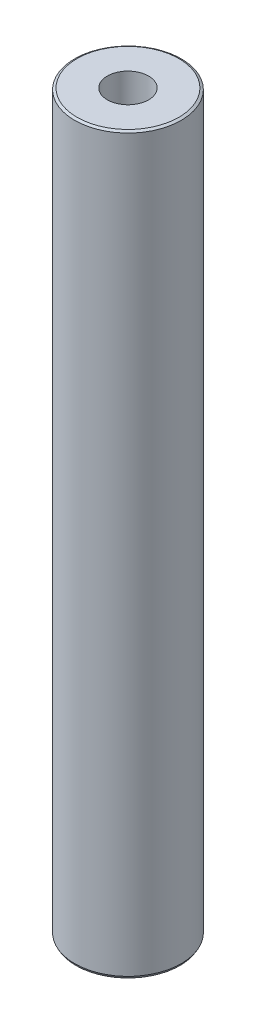
from build123d import *
from OCP.BRepFilletAPI import BRepFilletAPI_MakeChamfer

# Parameters (mm, degrees)
SKETCH1_R           = 22.5
BOSS_EXTRUDE1_DEPTH = 309.739403862
SKETCH2_R           = 8.718493885
CUT_EXTRUDE1_DEPTH  = 312.36955263
CHAMFER1_SIZE       = 0.589991103
CHAMFER1_SIZE2      = 1.021894566


with BuildPart() as part:
    # Sketch1 → Boss-Extrude1 (new body)
    with BuildSketch(Plane(origin=(0, 0, 0), x_dir=(1, 0, 0), z_dir=(0, 1, 0))):
        Circle(SKETCH1_R)
    extrude(amount=BOSS_EXTRUDE1_DEPTH)

    # Sketch2 → Cut-Extrude1 (cut, through all)
    with BuildSketch(Plane(origin=(0, 0, 0), x_dir=(1, 0, 0), z_dir=(0, 1, 0))):
        Circle(SKETCH2_R)
    extrude(amount=CUT_EXTRUDE1_DEPTH, mode=Mode.SUBTRACT)

    # Chamfer1: one chamfer whose edges measure the first distance from different faces: ONE call of the kernel's chamfer builder (chamfer() names one face for all edges)
    chamfer1_edges_1 = [part.edges().sort_by_distance(p)[0] for p in [
        (-22.5, 309.739403862, 0),
    ]]
    chamfer1_side_1 = [part.faces().sort_by_distance(p)[0] for p in [
        (-22.5, 154.869701931, 0),
    ]]
    chamfer1_edges_2 = [part.edges().sort_by_distance(p)[0] for p in [
        (-22.5, 0, 0),
    ]]
    chamfer1_side_2 = [part.faces().sort_by_distance(p)[0] for p in [
        (-21.863603897, 0, 0),
    ]]
    chamfer1 = BRepFilletAPI_MakeChamfer(part.part.solid().wrapped)
    for e in chamfer1_edges_1:
        chamfer1.Add(CHAMFER1_SIZE, CHAMFER1_SIZE2, e.wrapped, chamfer1_side_1[0].wrapped)  # the first distance lies on this face
    for e in chamfer1_edges_2:
        chamfer1.Add(CHAMFER1_SIZE, CHAMFER1_SIZE2, e.wrapped, chamfer1_side_2[0].wrapped)  # the first distance lies on this face
    add(Compound.cast(chamfer1.Shape()), mode=Mode.REPLACE)


solid = part.part
